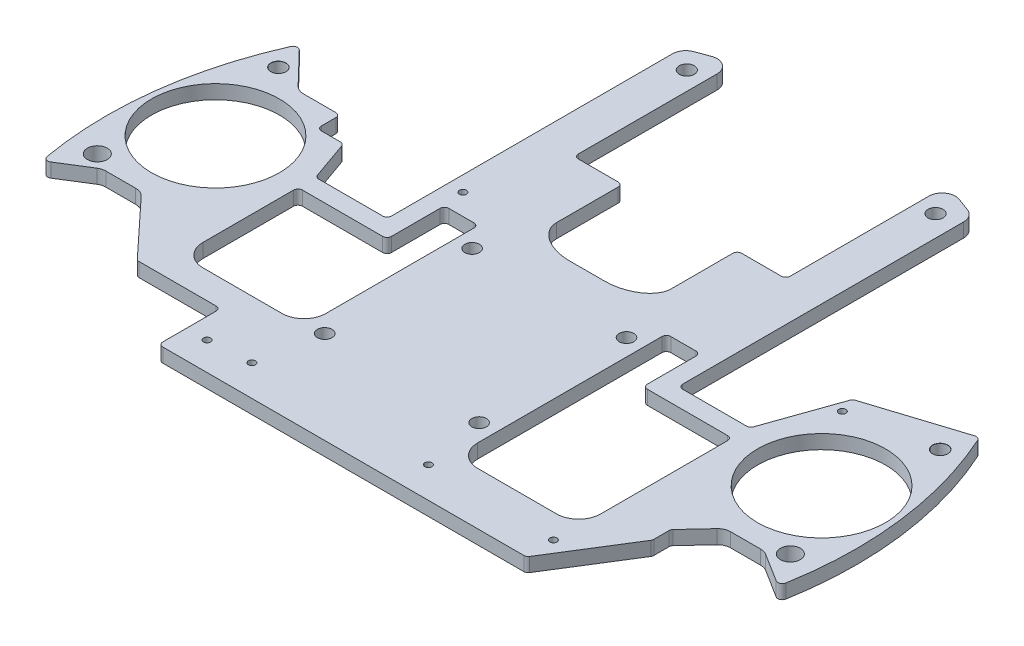
from build123d import *

# Parameters (mm, degrees)
BOSS_EXTRUDE1_OUTLINE_R        = 14.5
BOSS_EXTRUDE1_DEPTH            = 3.175
M4_CLEARANCE_HOLE1_D           = 4.5
F_3_3_3_3_DIAMETER_HOLE4_D     = 3.3
M3_CLEARANCE_HOLE2_D           = 3.4
M2X0_4_TAPPED_HOLE2_AT_2_COUNT = 2
M2X0_4_TAPPED_HOLE2_AT_2_PITCH = 86
M2X0_4_TAPPED_HOLE2_AT_3_COUNT = 2
M2X0_4_TAPPED_HOLE2_AT_3_PITCH = 103.730419839
M2X0_4_TAPPED_HOLE2_AT_4_COUNT = 2
M2X0_4_TAPPED_HOLE2_AT_4_PITCH = 58
M2X0_4_TAPPED_HOLE2_AT_5_COUNT = 2
M2X0_4_TAPPED_HOLE2_AT_5_PITCH = 97.602510214
FILLET1_R                      = 3
FILLET2_R                      = 1
FILLET3_SIZE                   = 6
FILLET3_SIZE_2                 = 9
FILLET4_R                      = 5
M3_CLEARANCE_HOLE1_D           = 3.4
M3_CLEARANCE_HOLE1_CSINK_D     = 3.45
M3_CLEARANCE_HOLE1_CSINK_ANGLE = 90
M2X0_4_TAPPED_HOLE1_D          = 1.6
CUT_EXTRUDE1_DEPTH             = 118.062568615
FILLET5_R                      = 1


with BuildPart() as part:
    # Boss-Extrude1: read off the stored shape, not the designer's step
    # Boss-Extrude1 outline → Boss-Extrude1 (new body)
    with BuildSketch(Plane(origin=(0, 0, 0), x_dir=(1, 0, 0), z_dir=(0, 1, 0))):
        with BuildLine():
            Line((33, 11.630595388), (33, 78.33262411))
            ThreePointArc((33, 78.33262411), (28.545123253, 80.063574355), (24, 81.541400528))
            Line((24, 81.541400528), (24, 45))
            Line((24, 45), (13, 45))
            Line((13, 45), (13, 24))
            Line((13, 24), (-13, 24))
            Line((-13, 24), (-13, 45))
            Line((-13, 45), (-24, 45))
            Line((-24, 45), (-24, 81.541400528))
            ThreePointArc((-24, 81.541400528), (-28.545123253, 80.063574355), (-33, 78.33262411))
            Line((-33, 78.33262411), (-33, 11.630595388))
            Line((-33, 11.630595388), (-49.185297029, 11.630595388))
            Line((-49.185297029, 11.630595388), (-52.624325057, 21.384301413))
            Line((-52.624325057, 21.384301413), (-58.624325057, 21.384301413))
            Line((-58.624325057, 21.384301413), (-58.624325057, 26.630595388))
            Line((-58.624325057, 26.630595388), (-68.191318528, 26.630595388))
            Line((-68.191318528, 26.630595388), (-77.073860284, 35.841596796))
            ThreePointArc((-77.073860284, 35.841596796), (-84.367778143, 10.347850562), (-83.451078309, -16.152941807))
            Line((-83.451078309, -16.152941807), (-75.073268231, -10.906716078))
            Line((-75.073268231, -10.906716078), (-66.121429656, -10.906716078))
            Line((-66.121429656, -10.906716078), (-53.091566877, -24.906716078))
            Line((-53.091566877, -24.906716078), (-34.205297029, -24.906716078))
            Line((-34.205297029, -24.906716078), (-34.205297029, -39))
            Line((-34.205297029, -39), (60.196181169, -39))
            Line((60.196181169, -39), (60.196181169, -17.27312839))
            Line((60.196181169, -17.27312839), (66.121429656, -10.906716078))
            Line((66.121429656, -10.906716078), (75.073268231, -10.906716078))
            Line((75.073268231, -10.906716078), (83.451078309, -16.152941807))
            ThreePointArc((83.451078309, -16.152941807), (84.367778143, 10.347850562), (77.073860284, 35.841596796))
            Line((77.073860284, 35.841596796), (55.268726082, 28.884301413))
            Line((55.268726082, 28.884301413), (49.185297029, 11.630595388))
            Line((49.185297029, 11.630595388), (33, 11.630595388))
        make_face()
        with Locations((-68.685297029, 8.424)):
            Circle(BOSS_EXTRUDE1_OUTLINE_R, mode=Mode.SUBTRACT)
        Polygon((-49.185297029, -18.906716078), (-49.185297029, 7.630595388), (-29, 7.630595388), (-29, 20.630595388), (-21.3, 20.630595388), (-21.3, -18.906716078), align=None, mode=Mode.SUBTRACT)
        Polygon((29, 20.630595388), (29, 7.630595388), (49.185297029, 7.630595388), (49.185297029, -27.138060345), (21.3, -27.138060345), (21.3, 20.630595388), align=None, mode=Mode.SUBTRACT)
        with Locations((68.685297029, 8.424)):
            Circle(BOSS_EXTRUDE1_OUTLINE_R, mode=Mode.SUBTRACT)
    extrude(amount=BOSS_EXTRUDE1_DEPTH)

    # M4 Clearance Hole1 (through all)
    with Locations(Plane(origin=(0, 3.175, 0), x_dir=(1, 0, 0), z_dir=(0, 1, 0))):
        with Locations((-78.54120923, -8.5016735), (78.54120923, -8.5016735)):
            Hole(M4_CLEARANCE_HOLE1_D / 2)

    # Ø3.3 (3.3) Diameter Hole4 (through all)
    with Locations(Plane(origin=(0, 3.175, 0), x_dir=(1, 0, 0), z_dir=(0, 1, 0))):
        with Locations((17.5, 15.4), (-17.5, -18), (-17.5, 15.4), (17.5, -18)):
            Hole(F_3_3_3_3_DIAMETER_HOLE4_D / 2)

    # M3 Clearance Hole2 (through all)
    with Locations(Plane(origin=(0, 3.175, 0), x_dir=(1, 0, 0), z_dir=(0, 1, 0))):
        with Locations((28.19, 74.751400528), (-28.19, 74.751400528)):
            Hole(M3_CLEARANCE_HOLE2_D / 2)

    # Sketch15 → M2x0.4 Tapped Hole2 (revolve, cut)
    with BuildSketch(Plane(origin=(-29.558455866, 3.175, -25.380595388), x_dir=(0, 0, 1), z_dir=(1, 0, 0))):
        Polygon((0, 0), (0, 3.175), (1.5, 3.175), (0.8, 2.475), (0.8, 0), align=None)
    m2x0_4_tapped_hole2 = revolve(axis=Axis((-29.558455866, 9.525, -25.380595388), (0, -1, 0)), mode=Mode.SUBTRACT)

    # M2x0.4 Tapped Hole2 at 2: M2x0.4 Tapped Hole2 ×2
    with Locations(*[(i * M2X0_4_TAPPED_HOLE2_AT_2_PITCH, 0, 0) for i in range(1, M2X0_4_TAPPED_HOLE2_AT_2_COUNT)]):
        add(m2x0_4_tapped_hole2, mode=Mode.SUBTRACT)

    # M2x0.4 Tapped Hole2 at 3: M2x0.4 Tapped Hole2 ×2
    with Locations(*[Vector(0.8290721288256765, 0, 0.5591416682777818) * (i * M2X0_4_TAPPED_HOLE2_AT_3_PITCH) for i in range(1, M2X0_4_TAPPED_HOLE2_AT_3_COUNT)]):
        add(m2x0_4_tapped_hole2, mode=Mode.SUBTRACT)

    # M2x0.4 Tapped Hole2 at 4: M2x0.4 Tapped Hole2 ×2
    with Locations(*[(0, 0, i * M2X0_4_TAPPED_HOLE2_AT_4_PITCH) for i in range(1, M2X0_4_TAPPED_HOLE2_AT_4_COUNT)]):
        add(m2x0_4_tapped_hole2, mode=Mode.SUBTRACT)

    # M2x0.4 Tapped Hole2 at 5: M2x0.4 Tapped Hole2 ×2
    with Locations(*[Vector(0.8042825930213097, 0, 0.59424701140428) * (i * M2X0_4_TAPPED_HOLE2_AT_5_PITCH) for i in range(1, M2X0_4_TAPPED_HOLE2_AT_5_COUNT)]):
        add(m2x0_4_tapped_hole2, mode=Mode.SUBTRACT)

    # Fillet1
    fillet1_edges = [part.edges().sort_by_distance(p)[0] for p in [
        (75.073268231, 1.5875, 10.906716078),
        (66.121429656, 1.5875, 10.906716078),
        (-66.121429656, 1.5875, 10.906716078),
        (-75.073268231, 1.5875, 10.906716078),
        (-68.191318528, 1.5875, -26.630595388),
        (-33, 1.5875, -78.33262411),
        (-24, 1.5875, -81.541400528),
        (24, 1.5875, -81.541400528),
        (33, 1.5875, -78.33262411),
    ]]
    fillet(fillet1_edges, radius=FILLET1_R)

    # Fillet2
    fillet2_edges = [part.edges().sort_by_distance(p)[0] for p in [
        (33, 1.5875, -11.630595388),
        (49.185297029, 1.5875, -11.630595388),
        (55.268726082, 1.5875, -28.884301413),
        (77.073860284, 1.5875, -35.841596796),
        (83.451078309, 1.5875, 16.152941807),
        (60.196181169, 1.5875, 17.27312839),
        (60.196181169, 1.5875, 39),
        (-34.205297029, 1.5875, 39),
        (-34.205297029, 1.5875, 24.906716078),
        (-53.091566877, 1.5875, 24.906716078),
        (-83.451078309, 1.5875, 16.152941807),
        (-77.073860284, 1.5875, -35.841596796),
        (-58.624325057, 1.5875, -26.630595388),
        (-58.624325057, 1.5875, -21.384301413),
        (-52.624325057, 1.5875, -21.384301413),
        (-49.185297029, 1.5875, -11.630595388),
        (-33, 1.5875, -11.630595388),
        (-24, 1.5875, -45),
        (-13, 1.5875, -45),
        (13, 1.5875, -45),
        (24, 1.5875, -45),
        (-49.185297029, 1.5875, -7.630595388),
        (-21.3, 1.5875, -20.630595388),
        (-29, 1.5875, -20.630595388),
        (-29, 1.5875, -7.630595388),
        (29, 1.5875, -20.630595388),
        (21.3, 1.5875, -20.630595388),
        (49.185297029, 1.5875, -7.630595388),
        (29, 1.5875, -7.630595388),
    ]]
    fillet(fillet2_edges, radius=FILLET2_R)

    # Fillet3
    # a fillet whose section is not a circle: 9, 6 mm, written as the material it adds along each edge
    with BuildSketch(Plane(origin=(13, 0, -24), x_dir=(0, 0, -1), z_dir=(0, 1, 0))) as fillet3_piece_1:
        with BuildLine():
            Bezier((FILLET3_SIZE, 0), (0, 0), (0, FILLET3_SIZE_2), weights=[1, 0.666666667, 1])
            Line((0, FILLET3_SIZE_2), (0, 0))
            Line((0, 0), (FILLET3_SIZE, 0))
        make_face()
    extrude(amount=3.175)
    with BuildSketch(Plane(origin=(-13, 0, -24), x_dir=(1, 0, 0), z_dir=(0, 1, 0))) as fillet3_piece_2:
        with BuildLine():
            Bezier((FILLET3_SIZE_2, 0), (0, 0), (0, FILLET3_SIZE), weights=[1, 0.666666667, 1])
            Line((0, FILLET3_SIZE), (0, 0))
            Line((0, 0), (FILLET3_SIZE_2, 0))
        make_face()
    extrude(amount=3.175)

    # Fillet4
    fillet4_edges = [part.edges().sort_by_distance(p)[0] for p in [
        (-49.185297029, 1.5875, 18.906716078),
        (-21.3, 1.5875, 18.906716078),
        (21.3, 1.5875, 27.138060345),
        (49.185297029, 1.5875, 27.138060345),
    ]]
    fillet(fillet4_edges, radius=FILLET4_R)

    # M3 Clearance Hole1 (through all)
    with Locations(Plane(origin=(0, 3.175, 0), x_dir=(1, 0, 0), z_dir=(0, 1, 0))):
        with Locations((75, 29), (-75, 29)):
            CounterSinkHole(M3_CLEARANCE_HOLE1_D / 2, M3_CLEARANCE_HOLE1_CSINK_D / 2, counter_sink_angle=M3_CLEARANCE_HOLE1_CSINK_ANGLE)

    # M2x0.4 Tapped Hole1 (through all)
    with Locations(Plane(origin=(0, 3.175, 0), x_dir=(1, 0, 0), z_dir=(0, 1, 0))):
        with Locations((-20, -32), (20, -32)):
            Hole(M2X0_4_TAPPED_HOLE1_D / 2)

    # Sketch32 → Cut-Extrude1 (cut, through all)
    with BuildSketch(Plane(origin=(0, 3.175, 0), x_dir=(1, 0, 0), z_dir=(0, 1, 0))):
        with BuildLine():
            Line((49.196181169, -39), (60.196181169, -21.396320181))
            Line((60.196181169, -21.396320181), (60.196181169, -38))
            ThreePointArc((60.196181169, -38), (59.90328795, -38.707106781), (59.196181169, -39))
            Line((59.196181169, -39), (49.196181169, -39))
        make_face()
    extrude(amount=-CUT_EXTRUDE1_DEPTH, mode=Mode.SUBTRACT)

    # Fillet5
    fillet5_edges = [part.edges().sort_by_distance(p)[0] for p in [
        (49.196181169, 1.5875, 39),
        (60.196181169, 1.5875, 21.396320181),
    ]]
    fillet(fillet5_edges, radius=FILLET5_R)


solid = part.part
